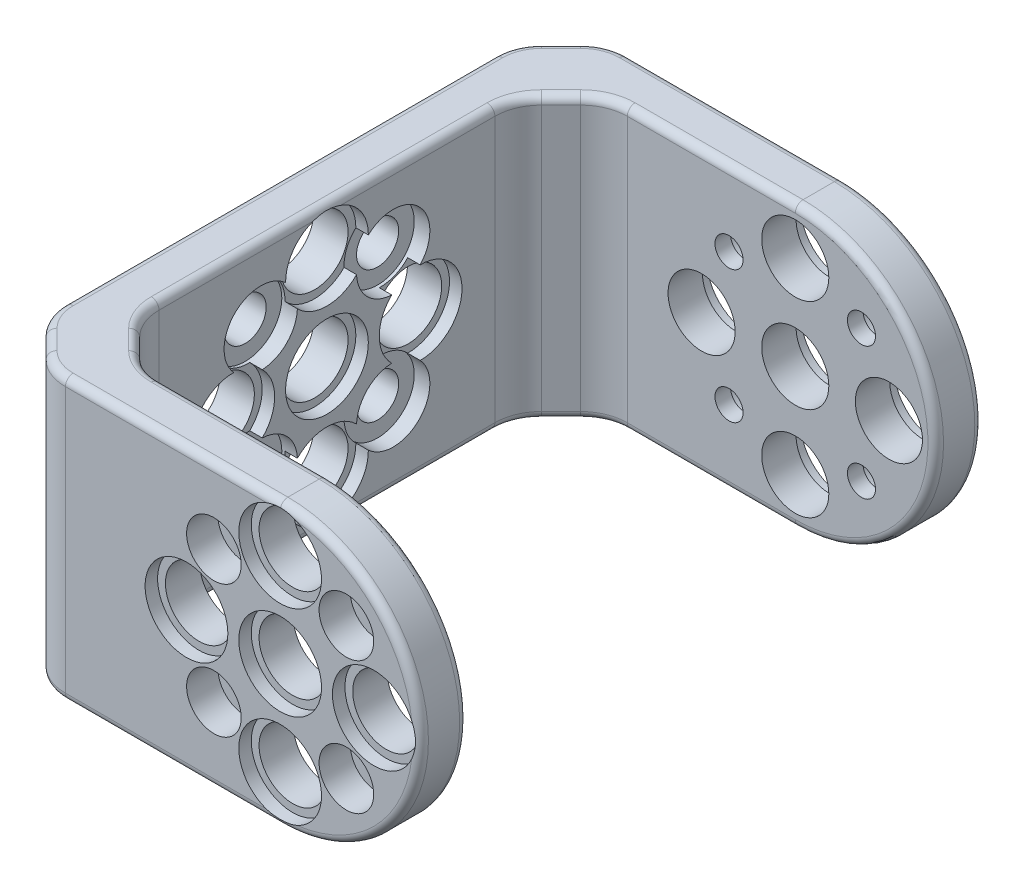
from build123d import *

# Parameters (mm, degrees)
BOSS_EXTRUDE1_DEPTH                                 = 18
SHELL1_T                                            = -3
CBORE_FOR_HEX_SOCKET_HEAD_CAP_SCREW1_D              = 1.8
CBORE_FOR_HEX_SOCKET_HEAD_CAP_SCREW1_CBORE_D        = 3.5
CBORE_FOR_HEX_SOCKET_HEAD_CAP_SCREW1_CBORE_DEPTH    = 2
HOLE1_D                                             = 4.3
HOLE1_CBORE_D                                       = 5.3
HOLE1_CBORE_DEPTH                                   = 0.8
HOLE2_D                                             = 4.3
HOLE2_DEPTH                                         = 15
HOLE2_CBORE_D                                       = 5.3
HOLE2_CBORE_DEPTH                                   = 0.8
CBORE_FOR_M2_HEX_SOCKET_HEAD_CAP_SCREW2_D           = 2.7
CBORE_FOR_M2_HEX_SOCKET_HEAD_CAP_SCREW2_CBORE_D     = 4.7
CBORE_FOR_M2_HEX_SOCKET_HEAD_CAP_SCREW2_CBORE_DEPTH = 1
CHAMFER1_SIZE                                       = 3
FILLET1_R                                           = 3
FILLET2_R                                           = 0.5


with BuildPart() as part:
    # Sketch3 → Boss-Extrude1 (new body)
    with BuildSketch(Plane.XY):
        with BuildLine():
            Line((-18, 9), (-18, -9))
            Line((-18, -9), (0, -9))
            ThreePointArc((0, -9), (9, 0), (0, 9))
            Line((0, 9), (-18, 9))
        make_face()
    extrude(amount=BOSS_EXTRUDE1_DEPTH)

    # Shell1
    shell1_openings = [part.faces().sort_by_distance(p)[0] for p in [
        (-5.385226499, 0, 0),
        (9, 0, 9),
        (-9, -9, 9),
        (-9, 9, 9),
    ]]
    offset(amount=SHELL1_T, openings=shell1_openings, kind=Kind.INTERSECTION)

    # CBORE for  Hex Socket Head Cap Screw1 (through all)
    with Locations(Plane.XY.offset(18)):
        with Locations((-4.242640687, 4.242640687), (4.242640687, 4.242640687), (4.242640687, -4.242640687), (-4.242640687, -4.242640687)):
            CounterBoreHole(CBORE_FOR_HEX_SOCKET_HEAD_CAP_SCREW1_D / 2, CBORE_FOR_HEX_SOCKET_HEAD_CAP_SCREW1_CBORE_D / 2, CBORE_FOR_HEX_SOCKET_HEAD_CAP_SCREW1_CBORE_DEPTH)

    # Hole1 (through all)
    with Locations(Plane.XY.offset(18)):
        with Locations((0, 6), (0, 0), (-6, 0), (0, -6), (6, 0)):
            CounterBoreHole(HOLE1_D / 2, HOLE1_CBORE_D / 2, HOLE1_CBORE_DEPTH)

    # Hole2
    with Locations(Plane(origin=(-15, 0, 0), x_dir=(0, 0, -1), z_dir=(1, 0, 0))):
        with Locations((0, 6), (0, 0), (0, -6), (-6, 0)):
            CounterBoreHole(HOLE2_D / 2, HOLE2_CBORE_D / 2, HOLE2_CBORE_DEPTH, depth=HOLE2_DEPTH)

    # CBORE for M2 Hex Socket Head Cap Screw2 (through all)
    with Locations(Plane(origin=(-15, 0, 0), x_dir=(0, 0, -1), z_dir=(1, 0, 0))):
        with Locations((-4.242640687, 4.242640687), (-4.242640687, -4.242640687)):
            CounterBoreHole(CBORE_FOR_M2_HEX_SOCKET_HEAD_CAP_SCREW2_D / 2, CBORE_FOR_M2_HEX_SOCKET_HEAD_CAP_SCREW2_CBORE_D / 2, CBORE_FOR_M2_HEX_SOCKET_HEAD_CAP_SCREW2_CBORE_DEPTH)

    # Chamfer1
    chamfer1_edges = [part.edges().sort_by_distance(p)[0] for p in [
        (-15, 0, 15),
        (-18, 0, 18),
    ]]
    chamfer(chamfer1_edges, length=CHAMFER1_SIZE)

    # Fillet1
    fillet1_edges = [part.edges().sort_by_distance(p)[0] for p in [
        (-15, 0, 12),
        (-12, 0, 15),
        (-15, 0, 18),
        (-18, 0, 15),
    ]]
    fillet(fillet1_edges, radius=FILLET1_R)

    # Fillet2
    # the kernel refuses this fillet: 0.5 mm, written as the material it takes off along each edge
    with BuildSketch(Plane(origin=(-15, -9, 10.757359313), x_dir=(-1, 0, 0), z_dir=(0, 0, -1)), Plane(origin=(-15, 9, -1.25), x_dir=(-1, 0, 0), z_dir=(0, 0, 1))) as fillet2_piece_1:
        with BuildLine():
            CenterArc((FILLET2_R, FILLET2_R), FILLET2_R, 180, 90)
            Line((0, FILLET2_R), (0, 0))
            Line((0, 0), (FILLET2_R, 0))
        make_face()
    extrude(amount=12.007359313, mode=Mode.SUBTRACT)
    with BuildSketch(Plane(origin=(-12, -9, 10.757359313), x_dir=(-1, 0, 0), z_dir=(0, 0, -1))) as fillet2_piece_2:
        with BuildLine():
            CenterArc((3 + FILLET2_R, FILLET2_R), FILLET2_R, 180, 90)
            Line((3, FILLET2_R), (3, 0))
            Line((3, 0), (3 + FILLET2_R, 0))
        make_face()
    revolve(axis=Axis((-12, -9, 10.757359313), (0, 1, 0)), revolution_arc=45, mode=Mode.SUBTRACT)
    with BuildSketch(Plane(origin=(-14.121320344, -9, 12.878679656), x_dir=(-0.7071067811865476, -3.552713678800508e-15, 0.7071067811865476), z_dir=(0.7071067811865476, 0, 0.7071067811865476)), Plane(origin=(-17.121320344, 9, 15.878679656), x_dir=(0.7071067811865476, 0, -0.7071067811865476), z_dir=(0.7071067811865476, 0, 0.7071067811865476))) as fillet2_piece_3:
        with BuildLine():
            CenterArc((FILLET2_R, -FILLET2_R), FILLET2_R, 90, 90)
            Line((0, -FILLET2_R), (0, 0))
            Line((0, 0), (FILLET2_R, 0))
        make_face()
    extrude(amount=1.757359313, mode=Mode.SUBTRACT)
    with BuildSketch(Plane(origin=(-10.757359313, -9, 12), x_dir=(-0.7071067811865478, 0, 0.7071067811865472), z_dir=(-0.7071067811865472, 0, -0.7071067811865478))) as fillet2_piece_4:
        with BuildLine():
            CenterArc((3 + FILLET2_R, FILLET2_R), FILLET2_R, 180, 90)
            Line((3, FILLET2_R), (3, 0))
            Line((3, 0), (3 + FILLET2_R, 0))
        make_face()
    revolve(axis=Axis((-10.757359313, -9, 12), (0, 1, 0)), revolution_arc=45, mode=Mode.SUBTRACT)
    with BuildSketch(Plane(origin=(-10.757359313, -9, 15), x_dir=(0, 0, 1), z_dir=(1, 0, 0)), Plane(origin=(0, 9, 15), x_dir=(0, 0, 1), z_dir=(-1, 0, 0))) as fillet2_piece_5:
        with BuildLine():
            CenterArc((FILLET2_R, -FILLET2_R), FILLET2_R, 90, 90)
            Line((0, -FILLET2_R), (0, 0))
            Line((0, 0), (FILLET2_R, 0))
        make_face()
    extrude(amount=10.757359313, mode=Mode.SUBTRACT)
    with BuildSketch(Plane(origin=(0, 0, 15), x_dir=(0, 1, 0), z_dir=(-1, 0, 0))) as fillet2_piece_6:
        with BuildLine():
            CenterArc((9 - FILLET2_R, -FILLET2_R), FILLET2_R, 0, 90)
            Line((9, -FILLET2_R), (9, 0))
            Line((9, 0), (9 - FILLET2_R, 0))
        make_face()
    revolve(axis=Axis((0, 0, 15), (0, 0, -1)), revolution_arc=180, mode=Mode.SUBTRACT)
    with BuildSketch(Plane(origin=(-10.757359313, 9, 12), x_dir=(-0.7071067811865478, 0, 0.7071067811865472), z_dir=(-0.7071067811865472, 0, -0.7071067811865478))) as fillet2_piece_7:
        with BuildLine():
            CenterArc((3 + FILLET2_R, -FILLET2_R), FILLET2_R, 90, 90)
            Line((3, -FILLET2_R), (3, 0))
            Line((3, 0), (3 + FILLET2_R, 0))
        make_face()
    revolve(axis=Axis((-10.757359313, 9, 12), (0, 1, 0)), revolution_arc=45, mode=Mode.SUBTRACT)
    with BuildSketch(Plane(origin=(-14.121320344, 9, 12.878679656), x_dir=(-0.7071067811865476, 0, 0.7071067811865476), z_dir=(0.7071067811865476, 0, 0.7071067811865476)), Plane(origin=(-17.121320344, -9, 15.878679656), x_dir=(0.7071067811865476, -3.552713678800508e-15, -0.7071067811865476), z_dir=(0.7071067811865476, 0, 0.7071067811865476))) as fillet2_piece_8:
        with BuildLine():
            CenterArc((FILLET2_R, FILLET2_R), FILLET2_R, 180, 90)
            Line((0, FILLET2_R), (0, 0))
            Line((0, 0), (FILLET2_R, 0))
        make_face()
    extrude(amount=1.757359313, mode=Mode.SUBTRACT)
    with BuildSketch(Plane(origin=(-12, 9, 10.757359313), x_dir=(-1, 0, 0), z_dir=(0, 0, -1))) as fillet2_piece_9:
        with BuildLine():
            CenterArc((3 + FILLET2_R, -FILLET2_R), FILLET2_R, 90, 90)
            Line((3, -FILLET2_R), (3, 0))
            Line((3, 0), (3 + FILLET2_R, 0))
        make_face()
    revolve(axis=Axis((-12, 9, 10.757359313), (0, 1, 0)), revolution_arc=45, mode=Mode.SUBTRACT)
    with BuildSketch(Plane(origin=(-18, -9, -1.25), x_dir=(0, 1, 0), z_dir=(0, 0, 1))) as fillet2_piece_10:
        with BuildLine():
            CenterArc((FILLET2_R, -FILLET2_R), FILLET2_R, 90, 90)
            Line((0, -FILLET2_R), (0, 0))
            Line((0, 0), (FILLET2_R, 0))
        make_face()
    extrude(amount=15.007359313, mode=Mode.SUBTRACT)
    with BuildSketch(Plane(origin=(-15, -9, 13.757359313), x_dir=(-1, 0, 0), z_dir=(0, 0, -1))) as fillet2_piece_11:
        with BuildLine():
            CenterArc((3 - FILLET2_R, FILLET2_R), FILLET2_R, 270, 90)
            Line((3 - FILLET2_R, 0), (3, 0))
            Line((3, 0), (3, FILLET2_R))
        make_face()
    revolve(axis=Axis((-15, -9, 13.757359313), (0, 1, 0)), revolution_arc=45, mode=Mode.SUBTRACT)
    with BuildSketch(Plane(origin=(-13.757359313, -9, 15), x_dir=(-0.7071067811865466, 0, 0.7071067811865483), z_dir=(-0.7071067811865483, 0, -0.7071067811865466))) as fillet2_piece_12:
        with BuildLine():
            CenterArc((3 - FILLET2_R, FILLET2_R), FILLET2_R, 270, 90)
            Line((3, FILLET2_R), (3, 0))
            Line((3, 0), (3 - FILLET2_R, 0))
        make_face()
    revolve(axis=Axis((-13.757359313, -9, 15), (0, 1, 0)), revolution_arc=45, mode=Mode.SUBTRACT)
    with BuildSketch(Plane(origin=(-13.757359313, -9, 18), x_dir=(0, 0, -1), z_dir=(1, 0, 0)), Plane(origin=(0, 9, 18), x_dir=(0, 0, -1), z_dir=(-1, 0, 0))) as fillet2_piece_13:
        with BuildLine():
            CenterArc((FILLET2_R, FILLET2_R), FILLET2_R, 180, 90)
            Line((0, FILLET2_R), (0, 0))
            Line((0, 0), (FILLET2_R, 0))
        make_face()
    extrude(amount=13.757359313, mode=Mode.SUBTRACT)
    with BuildSketch(Plane(origin=(0, 0, 18), x_dir=(0, -1, 0), z_dir=(-1, 0, 0))) as fillet2_piece_14:
        with BuildLine():
            CenterArc((9 - FILLET2_R, -FILLET2_R), FILLET2_R, 0, 90)
            Line((9 - FILLET2_R, 0), (9, 0))
            Line((9, 0), (9, -FILLET2_R))
        make_face()
    revolve(axis=Axis((0, 0, 18), (0, 0, 1)), revolution_arc=180, mode=Mode.SUBTRACT)
    with BuildSketch(Plane(origin=(-18, 9, -1.25), x_dir=(0, -1, 0), z_dir=(0, 0, 1))) as fillet2_piece_15:
        with BuildLine():
            CenterArc((FILLET2_R, FILLET2_R), FILLET2_R, 180, 90)
            Line((0, FILLET2_R), (0, 0))
            Line((0, 0), (FILLET2_R, 0))
        make_face()
    extrude(amount=15.007359313, mode=Mode.SUBTRACT)
    with BuildSketch(Plane(origin=(-15, 9, 13.757359313), x_dir=(-1, 0, 0), z_dir=(0, 0, -1))) as fillet2_piece_16:
        with BuildLine():
            CenterArc((3 - FILLET2_R, -FILLET2_R), FILLET2_R, 0, 90)
            Line((3, -FILLET2_R), (3, 0))
            Line((3, 0), (3 - FILLET2_R, 0))
        make_face()
    revolve(axis=Axis((-15, 9, 13.757359313), (0, 1, 0)), revolution_arc=45, mode=Mode.SUBTRACT)
    with BuildSketch(Plane(origin=(-13.757359313, 9, 15), x_dir=(-0.7071067811865466, 0, 0.7071067811865483), z_dir=(-0.7071067811865483, 0, -0.7071067811865466))) as fillet2_piece_17:
        with BuildLine():
            CenterArc((3 - FILLET2_R, -FILLET2_R), FILLET2_R, 0, 90)
            Line((3, -FILLET2_R), (3, 0))
            Line((3, 0), (3 - FILLET2_R, 0))
        make_face()
    revolve(axis=Axis((-13.757359313, 9, 15), (0, 1, 0)), revolution_arc=45, mode=Mode.SUBTRACT)

    # Mirror1: part across plane


with BuildPart() as part_1:
    add(part.part)
    add(part.part.mirror(Plane.XY))


solid = part_1.part
